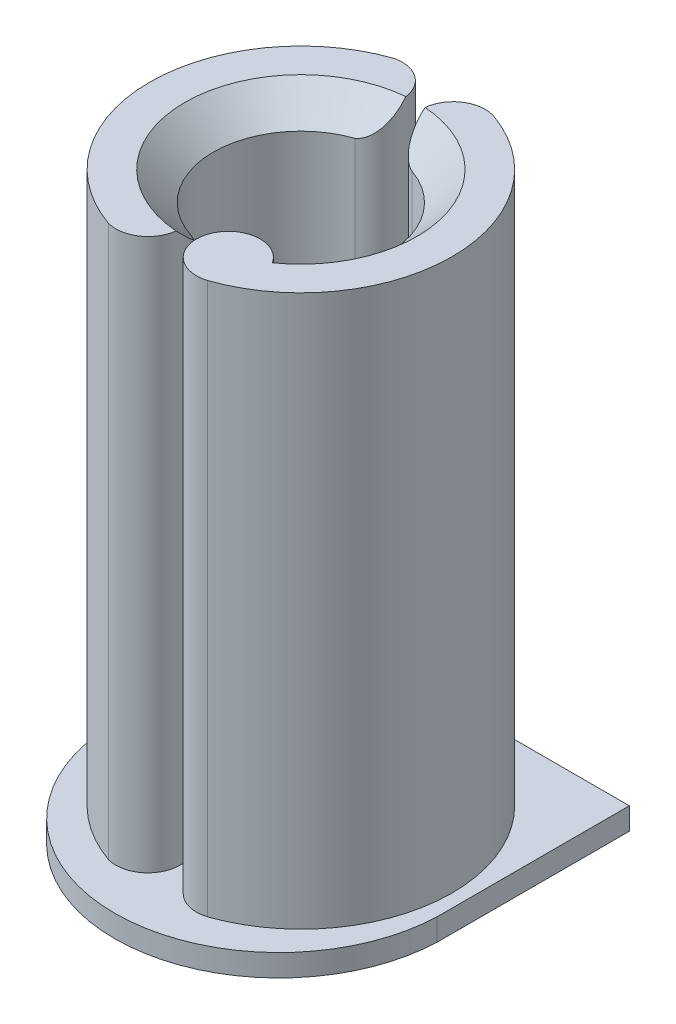
from build123d import *

# Parameters (mm, degrees)
RESSALTO_EXTRUS_O2_DEPTH = 0.1
RESSALTO_EXTRUS_O4_DEPTH = 2.5
CHANFRO4_SIZE            = 0.13
CHANFRO6_SIZE            = 0.13


with BuildPart() as part:
    # Esboço1 → Ressalto-extrusão2 (new body)
    with BuildSketch(Plane(origin=(0, 0, 0), x_dir=(1, 0, 0), z_dir=(0, 1, 0))):
        with BuildLine():
            Line((-0.745, -0.127313197), (-0.745, 0.745))
            Line((-0.745, 0.745), (0.745, 0.745))
            Line((0.745, 0.745), (0.745, -0.127313197))
            ThreePointArc((0.745, -0.127313197), (0, -0.84454219), (-0.745, -0.127313197))
        make_face()
    extrude(amount=RESSALTO_EXTRUS_O2_DEPTH)

    # Esboço2 → Ressalto-extrusão4 (add)
    with BuildSketch(Plane(origin=(0, 0.1, 0), x_dir=(1, 0, 0), z_dir=(0, 1, 0))):
        with BuildLine():
            ThreePointArc((-0.130138985, 0.374707495), (-0.396628803, -0.005239731), (-0.120195023, -0.378014575))
            ThreePointArc((-0.120195023, -0.378014575), (-0.050453859, -0.560369913), (-0.225, -0.64783959))
            ThreePointArc((-0.225, -0.64783959), (-0.685799631, 0), (-0.225, 0.64783959))
            ThreePointArc((-0.225, 0.64783959), (-0.055075167, 0.553816826), (-0.130138985, 0.374707495))
        make_face()
        with BuildLine():
            ThreePointArc((0.225, -0.64783959), (0.685793341, -0.00293739), (0.230541296, 0.645888415))
            ThreePointArc((0.230541296, 0.645888415), (0.046333691, 0.559912645), (0.130138985, 0.374707495))
            ThreePointArc((0.130138985, 0.374707495), (0.396647844, 0.00351428), (0.136757813, -0.372342803))
            ThreePointArc((0.136757813, -0.372342803), (0.043130513, -0.55421229), (0.225, -0.64783959))
        make_face()
    extrude(amount=RESSALTO_EXTRUS_O4_DEPTH)

    # Chanfro4
    chanfro4_edges = [part.edges().sort_by_distance(p)[0] for p in [
        (-0.396628803, 2.6, 0.005239731),
    ]]
    chamfer(chanfro4_edges, length=CHANFRO4_SIZE)

    # Chanfro6
    # the kernel refuses this chamfer: 0.13 mm, written as the material it takes off along each edge
    with BuildSketch(Plane(origin=(0, 2.6, 0), x_dir=(-0.4876362186378299, 0, -0.8730469164212188), z_dir=(-0.8730469164212188, 0, 0.4876362186378299))) as chanfro6_piece_1_section:
        Polygon((0.396663412, CHANFRO6_SIZE), (0.396663412 + CHANFRO6_SIZE, 0), (0.396663412, 0), align=None)
    chanfro6_piece_1 = revolve(axis=Axis((0, 2.6, 0), (0, -1, 0)), revolution_arc=237.355421361, mode=Mode.PRIVATE)
    chanfro6_piece_1 = chanfro6_piece_1 - Plane(origin=(0.180878906, 2.562353294, 0.510091196), x_dir=(-0.3050366551296925, 0, -0.9523406108253964), z_dir=(0, -1, 0)) * Cylinder(0.14464194, 3, mode=Mode.PRIVATE)
    add(chanfro6_piece_1, mode=Mode.SUBTRACT)


solid = part.part
